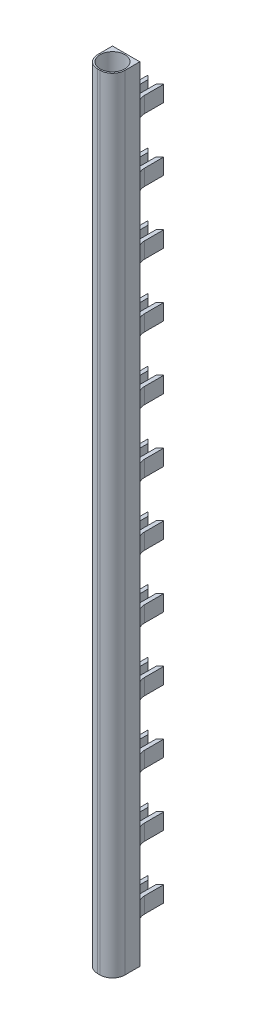
from build123d import *

# Parameters (mm, degrees)
SZKIC1_W                    = 1.1
SZKIC1_H                    = 1.1
DODANIE_WYCI_GNI_CIE1_DEPTH = 31.58
SZKIC2_R                    = 0.5
WYTNIJ_WYCI_GNI_CIE1_DEPTH  = 31.58
ZAOKR_GLENIE1_R             = 0.5
SZKIC3_W                    = 0.158842335
SZKIC3_H                    = 0.32
SZKIC3_W_2                  = 0.159565031
SZKIC3_H_2                  = 0.64
DODANIE_WYCI_GNI_CIE2_DEPTH = 1.3
ZAOKR_GLENIE2_R             = 0.5
SFAZOWANIE1_SIZE            = 0.25
ZAOKR_GLENIE3_R             = 0.01


with BuildPart() as part:
    # Szkic1 → Dodanie-wyciągnięcie1 (new body)
    with BuildSketch(Plane(origin=(0, 0, 0), x_dir=(1, 0, 0), z_dir=(0, 1, 0))):
        Rectangle(SZKIC1_W, SZKIC1_H)
    extrude(amount=DODANIE_WYCI_GNI_CIE1_DEPTH)

    # Szkic2 → Wytnij-wyciągnięcie1 (cut)
    with BuildSketch(Plane(origin=(0, 31.58, 0), x_dir=(1, 0, 0), z_dir=(0, 1, 0))):
        with Locations(Location((0, 0, 0), (0, 0, 270))):
            Circle(SZKIC2_R)
    extrude(amount=-WYTNIJ_WYCI_GNI_CIE1_DEPTH, mode=Mode.SUBTRACT)

    # Zaokrąglenie1
    zaokr_glenie1_edges = [part.edges().sort_by_distance(p)[0] for p in [
        (0.55, 15.79, 0.55),
        (-0.55, 15.79, 0.55),
    ]]
    fillet(zaokr_glenie1_edges, radius=ZAOKR_GLENIE1_R)

    # Szkic3 → Dodanie-wyciągnięcie2 (add)
    with BuildSketch(Plane(origin=(0, 0, -0.55), x_dir=(-1, 0, 0), z_dir=(0, 0, -1))):
        with Locations((-0.238263503, 1.66)):
            Rectangle(SZKIC3_W, SZKIC3_H)
        with Locations((-0.238263503, 1.98)):
            Rectangle(SZKIC3_W, SZKIC3_H)
        with Locations((0.239347548, 1.66)):
            Rectangle(SZKIC3_W_2, SZKIC3_H)
        with Locations((0.239347548, 1.98)):
            Rectangle(SZKIC3_W_2, SZKIC3_H)
        with Locations((-0.238263503, 4.36)):
            Rectangle(SZKIC3_W, SZKIC3_H_2)
        with Locations((0.239347548, 4.36)):
            Rectangle(SZKIC3_W_2, SZKIC3_H_2)
        with Locations((-0.238263503, 6.9)):
            Rectangle(SZKIC3_W, SZKIC3_H_2)
        with Locations((0.239347548, 6.9)):
            Rectangle(SZKIC3_W_2, SZKIC3_H_2)
        with Locations((-0.238263503, 9.44)):
            Rectangle(SZKIC3_W, SZKIC3_H_2)
        with Locations((0.239347548, 9.44)):
            Rectangle(SZKIC3_W_2, SZKIC3_H_2)
        with Locations((-0.238263503, 11.98)):
            Rectangle(SZKIC3_W, SZKIC3_H_2)
        with Locations((0.239347548, 11.98)):
            Rectangle(SZKIC3_W_2, SZKIC3_H_2)
        with Locations((-0.238263503, 14.52)):
            Rectangle(SZKIC3_W, SZKIC3_H_2)
        with Locations((0.239347548, 14.52)):
            Rectangle(SZKIC3_W_2, SZKIC3_H_2)
        with Locations((-0.238263503, 17.06)):
            Rectangle(SZKIC3_W, SZKIC3_H_2)
        with Locations((0.239347548, 17.06)):
            Rectangle(SZKIC3_W_2, SZKIC3_H_2)
        with Locations((-0.238263503, 19.6)):
            Rectangle(SZKIC3_W, SZKIC3_H_2)
        with Locations((0.239347548, 19.6)):
            Rectangle(SZKIC3_W_2, SZKIC3_H_2)
        with Locations((-0.238263503, 22.14)):
            Rectangle(SZKIC3_W, SZKIC3_H_2)
        with Locations((0.239347548, 22.14)):
            Rectangle(SZKIC3_W_2, SZKIC3_H_2)
        with Locations((-0.238263503, 24.68)):
            Rectangle(SZKIC3_W, SZKIC3_H_2)
        with Locations((0.239347548, 24.68)):
            Rectangle(SZKIC3_W_2, SZKIC3_H_2)
        with Locations((-0.238263503, 27.22)):
            Rectangle(SZKIC3_W, SZKIC3_H_2)
        with Locations((0.239347548, 27.22)):
            Rectangle(SZKIC3_W_2, SZKIC3_H_2)
        with Locations((-0.238263503, 29.76)):
            Rectangle(SZKIC3_W, SZKIC3_H_2)
        with Locations((0.239347548, 29.76)):
            Rectangle(SZKIC3_W_2, SZKIC3_H_2)
    extrude(amount=DODANIE_WYCI_GNI_CIE2_DEPTH)

    # Zaokrąglenie2
    # the kernel refuses this fillet: 0.5 mm, written as the material it adds along each edge
    with BuildSketch(Plane(origin=(0.31768467, 9.76, -0.55), x_dir=(1, 0, 0), z_dir=(0, -1, 0)), Plane(origin=(0.31768467, 12.3, -0.55), x_dir=(1, 0, 0), z_dir=(0, -1, 0)), Plane(origin=(0.31768467, 14.84, -0.55), x_dir=(1, 0, 0), z_dir=(0, -1, 0)), Plane(origin=(0.31768467, 17.38, -0.55), x_dir=(1, 0, 0), z_dir=(0, -1, 0)), Plane(origin=(0.31768467, 19.92, -0.55), x_dir=(1, 0, 0), z_dir=(0, -1, 0)), Plane(origin=(0.31768467, 22.46, -0.55), x_dir=(1, 0, 0), z_dir=(0, -1, 0)), Plane(origin=(0.31768467, 25, -0.55), x_dir=(1, 0, 0), z_dir=(0, -1, 0)), Plane(origin=(0.31768467, 27.54, -0.55), x_dir=(1, 0, 0), z_dir=(0, -1, 0)), Plane(origin=(0.31768467, 30.08, -0.55), x_dir=(1, 0, 0), z_dir=(0, -1, 0)), Plane(origin=(0.31768467, 4.68, -0.55), x_dir=(1, 0, 0), z_dir=(0, -1, 0)), Plane(origin=(0.31768467, 7.22, -0.55), x_dir=(1, 0, 0), z_dir=(0, -1, 0))) as zaokr_glenie2_piece_1:
        with BuildLine():
            CenterArc((0.5, -0.422309031), ZAOKR_GLENIE2_R, 122.368962551, 57.631037449)
            Line((0, -0.422309031), (-0.01, -0.422309031))
            Line((-0.01, -0.422309031), (-0.01, 0))
            Line((-0.01, 0), (0, 0.01))
            ThreePointArc((0, 0.01), (0.116157665, 0.01), (0.226961637, 0.008446181))
            Line((0.226961637, 0.008446181), (0.23231533, 0))
        make_face()
    extrude(amount=0.64)
    with BuildSketch(Plane(origin=(-0.319130063, 9.76, -0.55), x_dir=(-1, 0, 0), z_dir=(0, -1, 0)), Plane(origin=(-0.319130063, 12.3, -0.55), x_dir=(-1, 0, 0), z_dir=(0, -1, 0)), Plane(origin=(-0.319130063, 14.84, -0.55), x_dir=(-1, 0, 0), z_dir=(0, -1, 0)), Plane(origin=(-0.319130063, 17.38, -0.55), x_dir=(-1, 0, 0), z_dir=(0, -1, 0)), Plane(origin=(-0.319130063, 19.92, -0.55), x_dir=(-1, 0, 0), z_dir=(0, -1, 0)), Plane(origin=(-0.319130063, 22.46, -0.55), x_dir=(-1, 0, 0), z_dir=(0, -1, 0)), Plane(origin=(-0.319130063, 25, -0.55), x_dir=(-1, 0, 0), z_dir=(0, -1, 0)), Plane(origin=(-0.319130063, 27.54, -0.55), x_dir=(-1, 0, 0), z_dir=(0, -1, 0)), Plane(origin=(-0.319130063, 30.08, -0.55), x_dir=(-1, 0, 0), z_dir=(0, -1, 0)), Plane(origin=(-0.319130063, 2.14, -0.55), x_dir=(-1, 0, 0), z_dir=(0, -1, 0)), Plane(origin=(-0.319130063, 4.68, -0.55), x_dir=(-1, 0, 0), z_dir=(0, -1, 0)), Plane(origin=(-0.319130063, 7.22, -0.55), x_dir=(-1, 0, 0), z_dir=(0, -1, 0))) as zaokr_glenie2_piece_2:
        with BuildLine():
            CenterArc((0.5, 0.421389379), ZAOKR_GLENIE2_R, 180, 57.434723538)
            Line((0, 0.421389379), (-0.01, 0.421389379))
            Line((-0.01, 0.421389379), (-0.01, 0))
            Line((-0.01, 0), (0, -0.01))
            ThreePointArc((0, -0.01), (0.115434968, -0.01), (0.225487336, -0.008427788))
            Line((0.225487336, -0.008427788), (0.230869937, 0))
        make_face()
    extrude(amount=0.64)
    with BuildSketch(Plane(origin=(0.31768467, 1.5, -0.55), x_dir=(1, 0, 0), z_dir=(0, 1, 0))) as zaokr_glenie2_piece_3:
        with BuildLine():
            CenterArc((0.5, 0.422309031), ZAOKR_GLENIE2_R, 180, 57.631037449)
            Line((0, 0.422309031), (-0.01, 0.422309031))
            Line((-0.01, 0.422309031), (-0.01, 0))
            Line((-0.01, 0), (0, -0.01))
            ThreePointArc((0, -0.01), (0.116157665, -0.01), (0.226961637, -0.008446181))
            Line((0.226961637, -0.008446181), (0.23231533, 0))
        make_face()
    extrude(amount=0.64)

    # Sfazowanie1
    # the kernel refuses this chamfer: 0.25 mm, written as the material it takes off along each edge
    with BuildSketch(Plane(origin=(-0.159565032, 28.797079253, -1.85), x_dir=(-0.9996219169112968, 0, -0.027495876610586494), z_dir=(0, 1, 0)), Plane(origin=(-0.159565032, 26.257079253, -1.85), x_dir=(-0.9996219169112968, 0, -0.027495876610586494), z_dir=(0, 1, 0)), Plane(origin=(-0.159565032, 23.717079253, -1.85), x_dir=(-0.9996219169112968, 0, -0.027495876610586494), z_dir=(0, 1, 0)), Plane(origin=(-0.159565032, 21.177079253, -1.85), x_dir=(-0.9996219169112968, 0, -0.027495876610586494), z_dir=(0, 1, 0)), Plane(origin=(-0.159565032, 18.637079253, -1.85), x_dir=(-0.9996219169112968, 0, -0.027495876610586494), z_dir=(0, 1, 0)), Plane(origin=(-0.159565032, 16.097079253, -1.85), x_dir=(-0.9996219169112968, 0, -0.027495876610586494), z_dir=(0, 1, 0)), Plane(origin=(-0.159565032, 13.557079253, -1.85), x_dir=(-0.9996219169112968, 0, -0.027495876610586494), z_dir=(0, 1, 0)), Plane(origin=(-0.159565032, 11.017079253, -1.85), x_dir=(-0.9996219169112968, 0, -0.027495876610586494), z_dir=(0, 1, 0)), Plane(origin=(-0.159565032, 8.477079253, -1.85), x_dir=(-0.9996219169112968, 0, -0.027495876610586494), z_dir=(0, 1, 0)), Plane(origin=(-0.159565032, 5.937079253, -1.85), x_dir=(-0.9996219169112968, 0, -0.027495876610586494), z_dir=(0, 1, 0)), Plane(origin=(-0.159565032, 3.397079253, -1.85), x_dir=(-0.9996219169112968, 0, -0.027495876610586494), z_dir=(0, 1, 0)), Plane(origin=(-0.159565032, 0.857079253, -1.85), x_dir=(-0.9996219169112968, 0, -0.027495876610586494), z_dir=(0, 1, 0)), Plane(origin=(0.158842335, 2.782920747, -1.85), x_dir=(0.9996219169112968, 0, -0.027495876610586494), z_dir=(0, -1, 0))) as sfazowanie1_piece_1:
        Polygon((SFAZOWANIE1_SIZE * 0.999621916911, SFAZOWANIE1_SIZE * 0.0274958766106), (-SFAZOWANIE1_SIZE * 0.0274958766106, SFAZOWANIE1_SIZE * 0.999621916911), (0, 0), align=None)
    extrude(amount=1.925841494, mode=Mode.SUBTRACT)
    with BuildSketch(Plane(origin=(0.158842335, 28.797079253, -1.85), x_dir=(0.9996219169112968, 0, -0.027495876610586494), z_dir=(0, 1, 0)), Plane(origin=(0.158842335, 26.257079253, -1.85), x_dir=(0.9996219169112968, 0, -0.027495876610586494), z_dir=(0, 1, 0)), Plane(origin=(0.158842335, 23.717079253, -1.85), x_dir=(0.9996219169112968, 0, -0.027495876610586494), z_dir=(0, 1, 0)), Plane(origin=(0.158842335, 21.177079253, -1.85), x_dir=(0.9996219169112968, 0, -0.027495876610586494), z_dir=(0, 1, 0)), Plane(origin=(0.158842335, 18.637079253, -1.85), x_dir=(0.9996219169112968, 0, -0.027495876610586494), z_dir=(0, 1, 0)), Plane(origin=(0.158842335, 16.097079253, -1.85), x_dir=(0.9996219169112968, 0, -0.027495876610586494), z_dir=(0, 1, 0)), Plane(origin=(0.158842335, 13.557079253, -1.85), x_dir=(0.9996219169112968, 0, -0.027495876610586494), z_dir=(0, 1, 0)), Plane(origin=(0.158842335, 11.017079253, -1.85), x_dir=(0.9996219169112968, 0, -0.027495876610586494), z_dir=(0, 1, 0)), Plane(origin=(0.158842335, 8.477079253, -1.85), x_dir=(0.9996219169112968, 0, -0.027495876610586494), z_dir=(0, 1, 0)), Plane(origin=(0.158842335, 5.937079253, -1.85), x_dir=(0.9996219169112968, 0, -0.027495876610586494), z_dir=(0, 1, 0)), Plane(origin=(0.158842335, 3.397079253, -1.85), x_dir=(0.9996219169112968, 0, -0.027495876610586494), z_dir=(0, 1, 0))) as sfazowanie1_piece_2:
        Polygon((SFAZOWANIE1_SIZE * 0.999621916911, -SFAZOWANIE1_SIZE * 0.0274958766106), (-SFAZOWANIE1_SIZE * 0.0274958766106, -SFAZOWANIE1_SIZE * 0.999621916911), (0, 0), align=None)
    extrude(amount=1.925841494, mode=Mode.SUBTRACT)

    # Zaokrąglenie3
    zaokr_glenie3_edges = [part.edges().sort_by_distance(p)[0] for p in [
        (-0.319130063, 29.76, -1.759565032),
        (0.31768467, 29.76, -1.758842335),
        (-0.319130063, 27.22, -1.759565032),
        (0.31768467, 27.22, -1.758842335),
        (-0.319130063, 24.68, -1.759565032),
        (0.31768467, 24.68, -1.758842335),
        (-0.319130063, 22.14, -1.759565032),
        (0.31768467, 22.14, -1.758842335),
        (-0.319130063, 19.6, -1.759565032),
        (0.31768467, 19.6, -1.758842335),
        (-0.319130063, 17.06, -1.759565032),
        (0.31768467, 17.06, -1.758842335),
        (-0.319130063, 14.52, -1.759565032),
        (0.31768467, 14.52, -1.758842335),
        (-0.319130063, 11.98, -1.759565032),
        (0.31768467, 11.98, -1.758842335),
        (-0.319130063, 9.44, -1.759565032),
        (0.31768467, 9.44, -1.758842335),
        (-0.319130063, 6.9, -1.759565032),
        (0.31768467, 6.9, -1.758842335),
        (-0.319130063, 4.36, -1.759565032),
        (0.31768467, 4.36, -1.758842335),
        (-0.319130063, 1.82, -1.759565032),
        (0.31768467, 1.82, -1.758842335),
    ]]
    fillet(zaokr_glenie3_edges, radius=ZAOKR_GLENIE3_R)


solid = part.part
